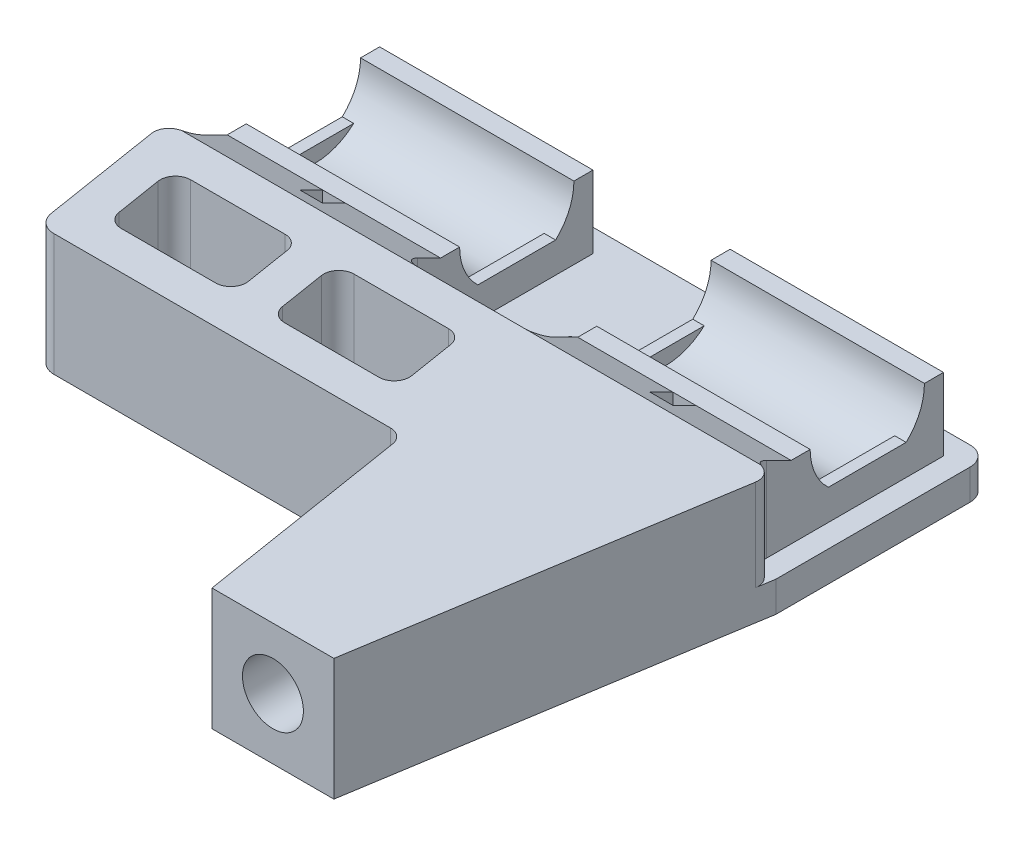
from build123d import *
from build123d.topology import SkipClean

# Parameters (mm, degrees)
SKETCH7_W           = 80
SKETCH7_H           = 28
EXTRUDE2_DEPTH      = 4
SKETCH8_W           = 28
SKETCH8_H           = 20
EXTRUDE3_DEPTH      = 9.5
EXTRUDE6_DEPTH      = 28
SKETCH15_R          = 7.5
EXTRUDE7_DEPTH      = 25
SKETCH16_W          = 3
SKETCH16_H          = 3
SKETCH8_4_W         = 28
SKETCH8_4_H         = 20
EXTRUDE8_DEPTH      = 9.5
EXTRUDE9_DEPTH      = 28
SKETCH19_R          = 7.5
EXTRUDE10_DEPTH     = 25
SKETCH20_W          = 3
SKETCH20_H          = 3
FILLET1_R           = 2.5
EXTRUDE11_DEPTH     = 16
SKETCH23_R          = 4
EXTRUDE12_DEPTH     = 40
SKETCH25_W          = 28
SKETCH25_H          = 5
EXTRUDE13_DEPTH     = 12
EXTRUDE14_REACH     = 90.69
FILLET2_R           = 2.5
FILLET9_R           = 2
FILLET10_R          = 2
FILLET11_R          = 2
SKETCH27_W          = 28
SKETCH27_H          = 5
EXTRUDE15_DEPTH     = 12
EXTRUDE16_REACH     = 90.69
FILLET12_R          = 2
FILLET13_R          = 2
FILLET14_R          = 2
FILLET15_R          = 2
SKETCH30_W          = 3
SKETCH30_H          = 3
EXTRUDE17_DEPTH     = 12
SKETCH31_W          = 3
SKETCH31_H          = 3
EXTRUDE18_DEPTH     = 12
FILLET16_R          = 2
EXTRUDE19_OUTLINE_R = 1.5
EXTRUDE19_DEPTH     = 4


# Read off the part's stored shape, not the designer's step: Extrude19
with BuildPart() as part:
    # Sketch7 → Extrude2 (new body)
    with BuildSketch(Plane(origin=(0, 0, 0), x_dir=(1, 0, 0), z_dir=(0, 1, 0))):
        with Locations((0, 23)):
            Rectangle(SKETCH7_W, SKETCH7_H)
    extrude(amount=EXTRUDE2_DEPTH)


with BuildPart() as body_2:
    # Sketch8 → Extrude3 (new body)
    with BuildSketch(Plane(origin=(0, 4, 0), x_dir=(1, 0, 0), z_dir=(0, 1, 0))):
        with Locations((-23, 24)):
            Rectangle(SKETCH8_W, SKETCH8_H)
    extrude(amount=EXTRUDE3_DEPTH)

    # Sketch10 → Extrude6 (cut)
    with BuildSketch(Plane(origin=(-9, 0, 0), x_dir=(0, 0, -1), z_dir=(1, 0, 0))):
        with BuildLine():
            Line((31.5, 13.5), (24, 13.5))
            Line((24, 13.5), (16.5, 13.5))
            ThreePointArc((16.5, 13.5), (17.126403912, 10.499387259), (18.900980486, 8))
            Line((18.900980486, 8), (29.099019514, 8))
            ThreePointArc((29.099019514, 8), (30.873596088, 10.499387259), (31.5, 13.5))
        make_face()
    extrude(amount=-EXTRUDE6_DEPTH, mode=Mode.SUBTRACT)

    # Sketch15 → Extrude7 (cut)
    with SkipClean():  # the faces are left unmerged after this step: merging them gives an invalid solid
        with BuildSketch(Plane.ZY.offset(35.5)):
            with Locations((-24, 13.5)):
                Circle(SKETCH15_R)
        extrude(amount=-EXTRUDE7_DEPTH, mode=Mode.SUBTRACT)


with BuildPart() as cut_sweep1_tool:
    # Cut-Sweep1: sweep along a path in Sketch17
    with SkipClean():  # the faces are left unmerged after this step: merging them gives an invalid solid
        with BuildLine(Plane(origin=(-23, 0, 0), x_dir=(0, 0, -1), z_dir=(1, 0, 0))) as cut_sweep1_path:
            CenterArc((24, 13.5), 12.806248475, 0, 360)
        # Sketch16 → Cut-Sweep1 (sweep)
        with BuildSketch(Plane.XY.offset(-14)):
            with Locations((-23, 5.5)):
                Rectangle(SKETCH16_W, SKETCH16_H)
        sweep(path=cut_sweep1_path.line)


with BuildPart() as part_1:
    with SkipClean():  # the faces are left unmerged after this step: merging them gives an invalid solid
        add(part.part)

        # Cut-Sweep1: cut by cut_sweep1_tool
        add(cut_sweep1_tool.part, mode=Mode.SUBTRACT)

    # Sketch8<4> → Extrude8 (add)
    with BuildSketch(Plane(origin=(0, 4, 0), x_dir=(1, 0, 0), z_dir=(0, 1, 0))):
        with Locations((23, 24)):
            Rectangle(SKETCH8_4_W, SKETCH8_4_H)
    extrude(amount=EXTRUDE8_DEPTH)

    # Sketch18 → Extrude9 (cut)
    with BuildSketch(Plane(origin=(37, 0, 0), x_dir=(0, 0, -1), z_dir=(1, 0, 0))):
        with BuildLine():
            Line((18.900980486, 8), (29.099019514, 8))
            ThreePointArc((29.099019514, 8), (30.873596088, 10.499387259), (31.5, 13.5))
            Line((31.5, 13.5), (16.5, 13.5))
            ThreePointArc((16.5, 13.5), (17.126403912, 10.499387259), (18.900980486, 8))
        make_face()
    extrude(amount=-EXTRUDE9_DEPTH, mode=Mode.SUBTRACT)

    # Sketch19 → Extrude10 (cut)
    with BuildSketch(Plane(origin=(35.5, 0, 0), x_dir=(0, 0, -1), z_dir=(1, 0, 0))):
        with Locations((24, 13.5)):
            Circle(SKETCH19_R)
    extrude(amount=-EXTRUDE10_DEPTH, mode=Mode.SUBTRACT)

    # Cut-Sweep2: sweep along a path in Sketch21
    with BuildLine(Plane(origin=(23, 0, 0), x_dir=(0, 0, -1), z_dir=(1, 0, 0))) as cut_sweep2_path:
        CenterArc((24, 13.5), 12.806248475, 0, 360)
    # Sketch20 → Cut-Sweep2 (sweep, cut)
    with BuildSketch(Plane.XY.offset(-14)):
        with Locations((23, 5.5)):
            Rectangle(SKETCH20_W, SKETCH20_H)
    sweep(path=cut_sweep2_path.line, mode=Mode.SUBTRACT)

    # Fillet1
    fillet1_edges = [part_1.edges().sort_by_distance(p)[0] for p in [
        (-40, 2, -37),
        (40, 2, -37),
    ]]
    fillet(fillet1_edges, radius=FILLET1_R)

    # Sketch22 → Extrude11 (add)
    with BuildSketch(Plane(origin=(0, 0, 0), x_dir=(1, 0, 0), z_dir=(0, 1, 0))):
        Polygon((11.215030697, -11.093941854), (16, -41), (32, -41), (40, 9), (-40, 9), (-36.784969303, -11.093941854), align=None)
        Polygon((3.73640444, 4), (5.351435136, -6.093941854), (-11.084969303, -6.093941854), (-12.7, 4), align=None, mode=Mode.SUBTRACT)
        Polygon((-16.084969303, -6.093941854), (-32.521373743, -6.093941854), (-34.13640444, 4), (-17.7, 4), align=None, mode=Mode.SUBTRACT)
    extrude(amount=EXTRUDE11_DEPTH)

    # Sketch23 → Extrude12 (cut)
    with BuildSketch(Plane.XY.offset(41)):
        with Locations((24, 8)):
            Circle(SKETCH23_R)
    extrude(amount=-EXTRUDE12_DEPTH, mode=Mode.SUBTRACT)



with BuildPart() as body_2_1:
    with SkipClean():  # the faces are left unmerged after this step: merging them gives an invalid solid
        add(body_2.part)

        # Cut-Sweep1: cut by cut_sweep1_tool
        add(cut_sweep1_tool.part, mode=Mode.SUBTRACT)


with BuildPart() as part_2:
    with SkipClean():  # the faces are left unmerged after this step: merging them gives an invalid solid
        add(part_1.part)

        add(body_2_1.part)  # Extrude13 merges body 2
        # Sketch25 → Extrude13 (add)
        with BuildSketch(Plane(origin=(0, 4, 0), x_dir=(-1, 0, 0), z_dir=(0, 1, 0))):
            with Locations((23, -11.5)):
                Rectangle(SKETCH25_W, SKETCH25_H)
        extrude(amount=EXTRUDE13_DEPTH)

    # Sketch26 → Extrude14 (cut, up to next)
    with BuildSketch(Plane.ZY.offset(37), mode=Mode.PRIVATE) as extrude14_sk1:
        Polygon((-14, 13.5), (-9, 16), (-14, 16), align=None)
    extrude14_tool1 = extrude(extrude14_sk1.sketch, amount=-EXTRUDE14_REACH, mode=Mode.PRIVATE) & part_2.part
    add(extrude14_tool1.solids().sort_by_distance((-37, 15.166667, -12.333333))[0], mode=Mode.SUBTRACT)

    # Fillet2
    fillet2_edges = [part_2.edges().sort_by_distance(p)[0] for p in [
        (-36.784969303, 8, 11.093941854),
    ]]
    fillet(fillet2_edges, radius=FILLET2_R)

    # Fillet9
    fillet9_edges = [part_2.edges().sort_by_distance(p)[0] for p in [
        (-40, 10, -9),
    ]]
    fillet(fillet9_edges, radius=FILLET9_R)

    # Fillet10
    # the kernel refuses this fillet: 2 mm, written as the material it adds along each edge
    with BuildSketch(Plane(origin=(-37, 4, -9), x_dir=(0, 0, -1), z_dir=(0, 1, 0))) as fillet10_piece_1_section:
        with BuildLine():
            CenterArc((1.766934561, 2), FILLET10_R, 199.655233066, 70.344766934)
            Line((-0.11653272, 1.327280888), (-0.304879448, 1.260008977))
            ThreePointArc((-0.304879448, 1.260008977), (-0.2, 0.654561776), (-0.2, 0))
            Line((-0.2, 0), (0, -0.2))
            Line((0, -0.2), (1.766934561, -0.2))
            Line((1.766934561, -0.2), (1.766934561, 0))
        make_face()
    fillet10_piece_1 = extrude(amount=12, mode=Mode.PRIVATE)
    fillet10_piece_1 = split(fillet10_piece_1, bisect_by=Plane(origin=(-37.361885023, 14.554978546, -11.890042908), z_dir=(0, -0.8944271909999159, 0.44721359549995804)), keep=Keep.TOP, mode=Mode.PRIVATE)
    add(fillet10_piece_1)

    # Fillet11
    # the kernel refuses this fillet: 2 mm, written as the material it adds along each edge
    with BuildSketch(Plane(origin=(-9, 4, -9), x_dir=(1, 0, 0), z_dir=(0, 1, 0))) as fillet11_piece_1_section:
        with BuildLine():
            CenterArc((FILLET11_R, FILLET11_R), FILLET11_R, 180, 90)
            Line((0, FILLET11_R), (0, 0))
            Line((0, 0), (FILLET11_R, 0))
        make_face()
    fillet11_piece_1 = extrude(amount=17, mode=Mode.PRIVATE)
    fillet11_piece_1 = split(fillet11_piece_1, bisect_by=Plane(origin=(-8.54975152, 14.60165577, -11.796688461), z_dir=(0, -0.894427190999916, 0.447213595499958)), keep=Keep.TOP, mode=Mode.PRIVATE)
    add(fillet11_piece_1)

    # Sketch27 → Extrude15 (add)
    with BuildSketch(Plane(origin=(0, 4, 0), x_dir=(-1, 0, 0), z_dir=(0, 1, 0))):
        with Locations((-23, -11.5)):
            Rectangle(SKETCH27_W, SKETCH27_H)
    extrude(amount=EXTRUDE15_DEPTH)

    # Sketch28 → Extrude16 (cut, up to next)
    with BuildSketch(Plane(origin=(37, 0, 0), x_dir=(0, 0, -1), z_dir=(1, 0, 0)), mode=Mode.PRIVATE) as extrude16_sk1:
        Polygon((14, 13.5), (9, 16), (14, 16), align=None)
    extrude16_tool1 = extrude(extrude16_sk1.sketch, amount=-EXTRUDE16_REACH, mode=Mode.PRIVATE) & part_2.part
    add(extrude16_tool1.solids().sort_by_distance((37, 15.166667, -12.333333))[0], mode=Mode.SUBTRACT)

    # Fillet12
    fillet12_edges = [part_2.edges().sort_by_distance(p)[0] for p in [
        (40, 10, -9),
    ]]
    fillet(fillet12_edges, radius=FILLET12_R)

    # Fillet13
    # the kernel refuses this fillet: 2 mm, written as the material it adds along each edge
    with BuildSketch(Plane(origin=(37, -0.417336402, -9), x_dir=(0.9961678888786428, 0, 0.08746163254289291), z_dir=(0, 1, 0))) as fillet13_piece_1_section:
        with BuildLine():
            CenterArc((1.837796796, 1.935086736), FILLET13_R, 185.017593378, 70.344766934)
            Line((-0.154538981, 1.760163471), (-0.353772559, 1.742671145))
            Line((-0.353772559, 1.742671145), (-0.199233578, -0.017492327))
            Line((-0.199233578, -0.017492327), (0.017492327, -0.199233578))
            ThreePointArc((0.017492327, -0.199233578), (0.669545749, -0.141984536), (1.281845737, -0.193508674))
            Line((1.281845737, -0.193508674), (1.332386742, 0))
        make_face()
    fillet13_piece_1 = extrude(amount=16.417336402, mode=Mode.PRIVATE)
    fillet13_piece_1 = split(fillet13_piece_1, bisect_by=Plane(origin=(37.361885023, 14.554978546, -11.890042908), z_dir=(0, -0.8944271909999157, 0.4472135954999582)), keep=Keep.TOP, mode=Mode.PRIVATE)
    fillet13_piece_1 = split(fillet13_piece_1, bisect_by=Plane(origin=(37.361885023, 0, -9.612553635), z_dir=(0, 1, 0)), keep=Keep.TOP, mode=Mode.PRIVATE)
    add(fillet13_piece_1)

    # Fillet14
    # the kernel refuses this fillet: 2 mm, written as the material it adds along each edge
    with BuildSketch(Plane(origin=(9, 4, -9), x_dir=(0, 0, -1), z_dir=(0, 1, 0))) as fillet14_piece_1_section:
        with BuildLine():
            CenterArc((FILLET14_R, FILLET14_R), FILLET14_R, 180, 90)
            Line((0, FILLET14_R), (0, 0))
            Line((0, 0), (FILLET14_R, 0))
        make_face()
    fillet14_piece_1 = extrude(amount=17, mode=Mode.PRIVATE)
    fillet14_piece_1 = split(fillet14_piece_1, bisect_by=Plane(origin=(8.54975152, 14.60165577, -11.796688461), z_dir=(0, -0.894427190999916, 0.447213595499958)), keep=Keep.TOP, mode=Mode.PRIVATE)
    add(fillet14_piece_1)

    # Fillet15
    fillet15_edges = [part_2.edges().sort_by_distance(p)[0] for p in [
        (-12.7, 8, -4),
        (-11.084969303, 8, 6.093941854),
        (5.351435136, 8, 6.093941854),
        (3.73640444, 8, -4),
        (-17.7, 8, -4),
        (-34.13640444, 8, -4),
        (-32.521373743, 8, 6.093941854),
        (-16.084969303, 8, 6.093941854),
    ]]
    fillet(fillet15_edges, radius=FILLET15_R)

    # Sketch30 → Extrude17 (cut)
    with BuildSketch(Plane(origin=(0, 16, 0), x_dir=(-1, 0, 0), z_dir=(0, 1, 0))):
        with Locations((-23, -12.5)):
            Rectangle(SKETCH30_W, SKETCH30_H)
    extrude(amount=-EXTRUDE17_DEPTH, mode=Mode.SUBTRACT)

    # Sketch31 → Extrude18 (cut)
    with BuildSketch(Plane(origin=(0, 16, 0), x_dir=(-1, 0, 0), z_dir=(0, 1, 0))):
        with Locations((23, -12.5)):
            Rectangle(SKETCH31_W, SKETCH31_H)
    extrude(amount=-EXTRUDE18_DEPTH, mode=Mode.SUBTRACT)

    # Fillet16
    fillet16_edges = [part_2.edges().sort_by_distance(p)[0] for p in [
        (11.215030697, 8, 11.093941854),
    ]]
    fillet(fillet16_edges, radius=FILLET16_R)

    # Extrude19 outline → Extrude19 (cut)
    with BuildSketch(Plane(origin=(0, 0, 0), x_dir=(1, 0, 0), z_dir=(0, 1, 0))):
        with Locations((0, 22)):
            Circle(EXTRUDE19_OUTLINE_R)
        with Locations((0, 13.5)):
            Circle(EXTRUDE19_OUTLINE_R)
    extrude(amount=EXTRUDE19_DEPTH, mode=Mode.SUBTRACT)


solid = part_2.part
